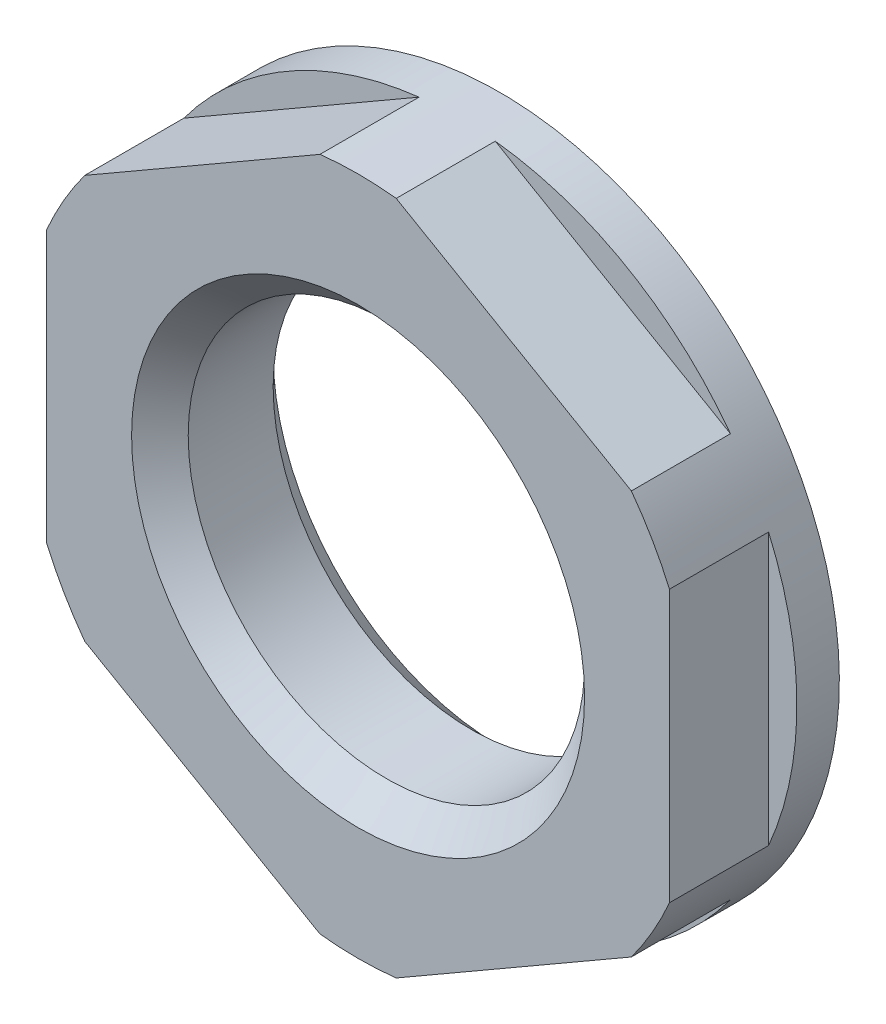
from build123d import *
from build123d.topology import SkipClean

# Parameters (mm, degrees)
EXTRUDE_1_DEPTH     = 5
SKETCH_2_R          = 12.701705922
SKETCH_2_R_2        = 12
CUT_EXTRUDE_1_DEPTH = 18.530925056
EXTRUDE_START       = -1.5
SKETCH_4_R          = 12
EXTRUDE_3_DEPTH     = 1.5
SKETCH_5_R          = 7
CUT_EXTRUDE_2_DEPTH = 18.691806013
CHAMFER_1_SIZE      = 1


with BuildPart() as part:
    # Эскиз1 → Вытянуть1 (new body)
    with BuildSketch(Plane.XY):
        Polygon((0, 12.701705922), (-11, 6.350852961), (-11, -6.350852961), (0, -12.701705922), (11, -6.350852961), (11, 6.350852961), align=None)
    extrude(amount=EXTRUDE_1_DEPTH)

    # Эскиз2 → Вырез-Вытянуть1 (cut, through all)
    with BuildSketch(Plane.XY.offset(5)):
        Circle(SKETCH_2_R)
        Circle(SKETCH_2_R_2, mode=Mode.SUBTRACT)
    extrude(amount=-CUT_EXTRUDE_1_DEPTH, mode=Mode.SUBTRACT)

    # Эскиз4 → Вытянуть3 (add)
    with SkipClean():  # the faces are left unmerged after this step: merging them gives an invalid solid
        with BuildSketch(Plane(origin=(0, 0, 0), x_dir=(-1, 0, 0), z_dir=(0, 0, -1)).offset(EXTRUDE_START)):
            Circle(SKETCH_4_R)
        extrude(amount=EXTRUDE_3_DEPTH)
    add(part.part.scale(1), mode=Mode.REPLACE)  # the faces are merged on a copy

    # Эскиз5 → Вырез-Вытянуть2 (cut, through all)
    with BuildSketch(Plane.XY.offset(5)):
        Circle(SKETCH_5_R)
    extrude(amount=-CUT_EXTRUDE_2_DEPTH, mode=Mode.SUBTRACT)

    # Фаска1
    chamfer_1_edges = [part.edges().sort_by_distance(p)[0] for p in [
        (-7, 0, 0),
        (-7, 0, 5),
    ]]
    chamfer(chamfer_1_edges, length=CHAMFER_1_SIZE)


solid = part.part
